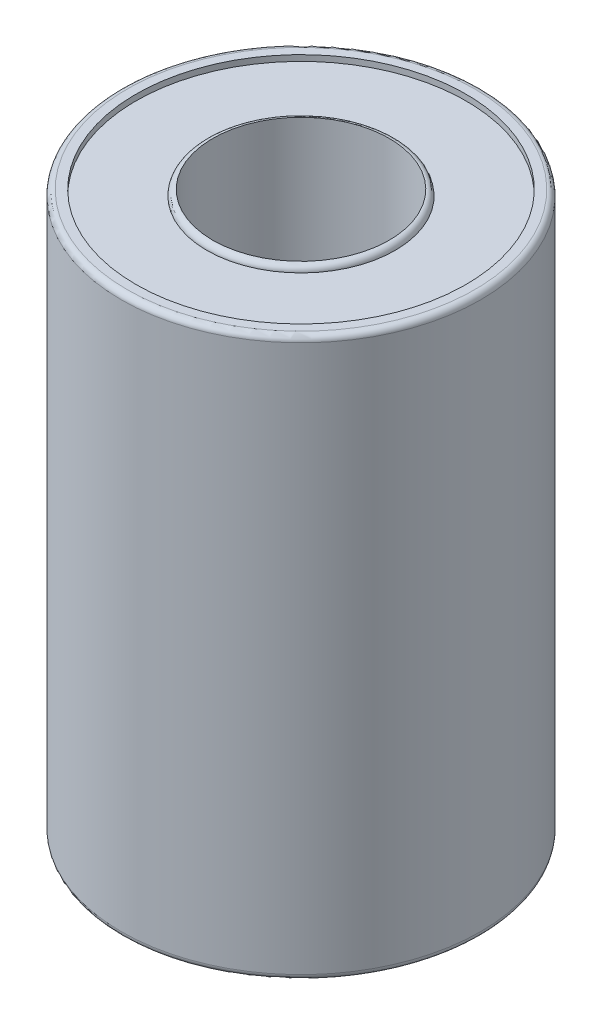
from build123d import *

# Parameters (mm, degrees)
EXTRUDE_START   = 0.2
SKETCH_1_R      = 6
SKETCH_1_R_2    = 3
EXTRUDE_1_DEPTH = 18.6
SKETCH_2_R      = 6.108417227
SKETCH_2_R_2    = 5.608417227
SKETCH_2_R_3    = 3.2
SKETCH_2_R_4    = 3
EXTRUDE_2_DEPTH = 19
FILLET_1_R      = 0.2


with BuildPart() as part:
    # 草图1 → 凸台-拉伸1 (new body)
    with BuildSketch(Plane(origin=(0, 0, 0), x_dir=(1, 0, 0), z_dir=(0, 1, 0)).offset(EXTRUDE_START)):
        with Locations(Location((0, 0, 0), (0, 0, 270))):
            Circle(SKETCH_1_R)
        with Locations(Location((0, 0, 0), (0, 0, 270))):
            Circle(SKETCH_1_R_2, mode=Mode.SUBTRACT)
    extrude(amount=EXTRUDE_1_DEPTH)

    # 草图2 → 凸台-拉伸2 (add)
    # profile 1 of 2: a face of its own
    with BuildSketch(Plane(origin=(0, 0, 0), x_dir=(1, 0, 0), z_dir=(0, 1, 0))):
        with Locations(Location((0, 0, 0), (0, 0, 270))):
            Circle(SKETCH_2_R)
        with Locations(Location((0, 0, 0), (0, 0, 270))):
            Circle(SKETCH_2_R_2, mode=Mode.SUBTRACT)
    # profile 2 of 2: a face of its own
    with BuildSketch(Plane(origin=(0, 0, 0), x_dir=(1, 0, 0), z_dir=(0, 1, 0))):
        with Locations(Location((0, 0, 0), (0, 0, 270))):
            Circle(SKETCH_2_R_3)
        with Locations(Location((0, 0, 0), (0, 0, 270))):
            Circle(SKETCH_2_R_4, mode=Mode.SUBTRACT)
    extrude(amount=EXTRUDE_2_DEPTH)

    # 圆角1
    fillet_1_edges = [part.edges().sort_by_distance(p)[0] for p in [
        (0, 0, -6.108417227),
        (0, 19, -6.108417227),
        (0, 0, -3.2),
        (0, 19, -3.2),
    ]]
    fillet(fillet_1_edges, radius=FILLET_1_R - 0.0001)  # a hair under: the kernel refuses the full size


solid = part.part
